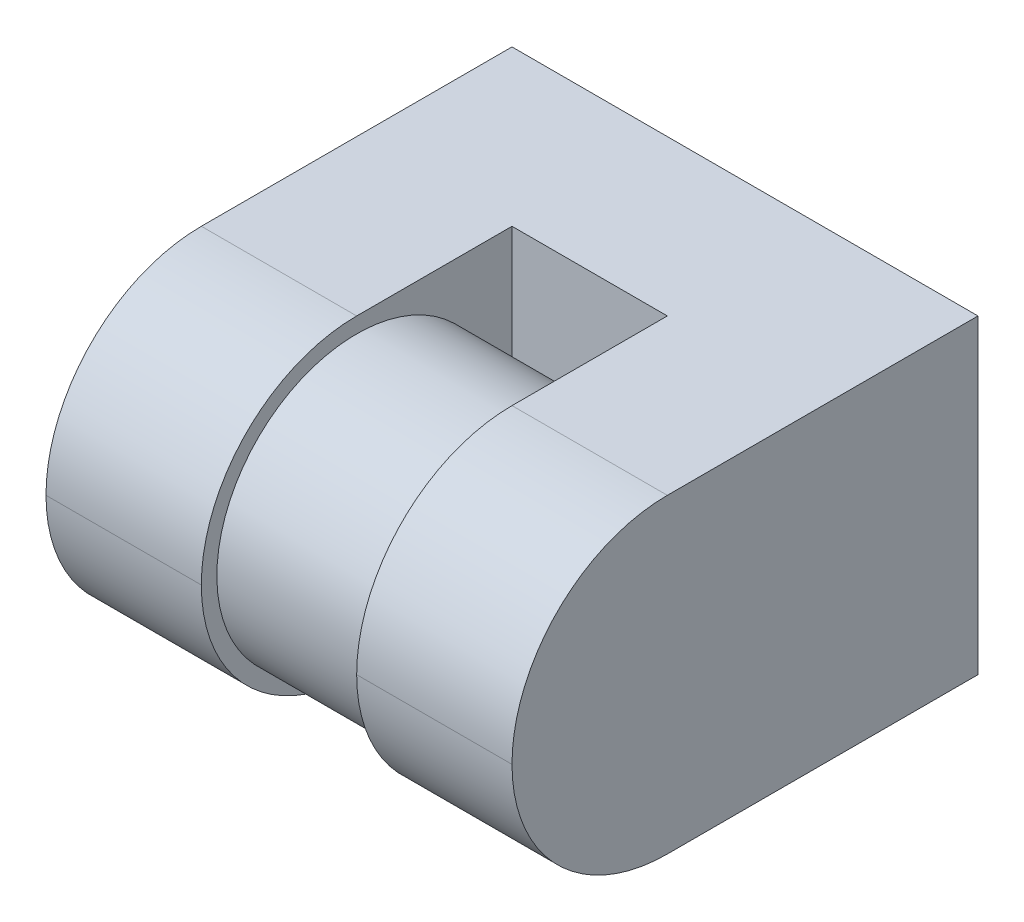
from build123d import *

# Parameters (mm, degrees)
SZKIC1_W                    = 30
SZKIC1_H                    = 20
SZKIC1_R                    = 2.6
DODANIE_WYCI_GNI_CIE1_DEPTH = 10
SZKIC2_W                    = 10
SZKIC2_H                    = 20
DODANIE_WYCI_GNI_CIE2_DEPTH = 20
SZKIC3_R                    = 9
DODANIE_WYCI_GNI_CIE3_DEPTH = 10
ZAOKR_GLENIE1_R             = 10


with BuildPart() as part:
    # Szkic1 → Dodanie-wyciągnięcie1 (new body)
    with BuildSketch(Plane.XY):
        with Locations((15, 10)):
            Rectangle(SZKIC1_W, SZKIC1_H)
        with Locations((15, 10)):
            Circle(SZKIC1_R, mode=Mode.SUBTRACT)
    extrude(amount=DODANIE_WYCI_GNI_CIE1_DEPTH)

    # Szkic2 → Dodanie-wyciągnięcie2 (add)
    with BuildSketch(Plane.XY.offset(10)):
        with Locations((5, 10)):
            Rectangle(SZKIC2_W, SZKIC2_H)
        with Locations((25, 10)):
            Rectangle(SZKIC2_W, SZKIC2_H)
    extrude(amount=DODANIE_WYCI_GNI_CIE2_DEPTH)

    # Szkic3 → Dodanie-wyciągnięcie3 (add)
    with BuildSketch(Plane(origin=(10, 0, 0), x_dir=(0, 0, -1), z_dir=(1, 0, 0))):
        with Locations(Location((-20, 10, 0), (0, 0, 270))):
            Circle(SZKIC3_R)
    extrude(amount=DODANIE_WYCI_GNI_CIE3_DEPTH)

    # Zaokrąglenie1
    zaokr_glenie1_edges = [part.edges().sort_by_distance(p)[0] for p in [
        (25, 0, 30),
        (5, 0, 30),
        (25, 20, 30),
        (5, 20, 30),
    ]]
    fillet(zaokr_glenie1_edges, radius=ZAOKR_GLENIE1_R - 0.0001)  # a hair under: the kernel refuses the full size


solid = part.part
